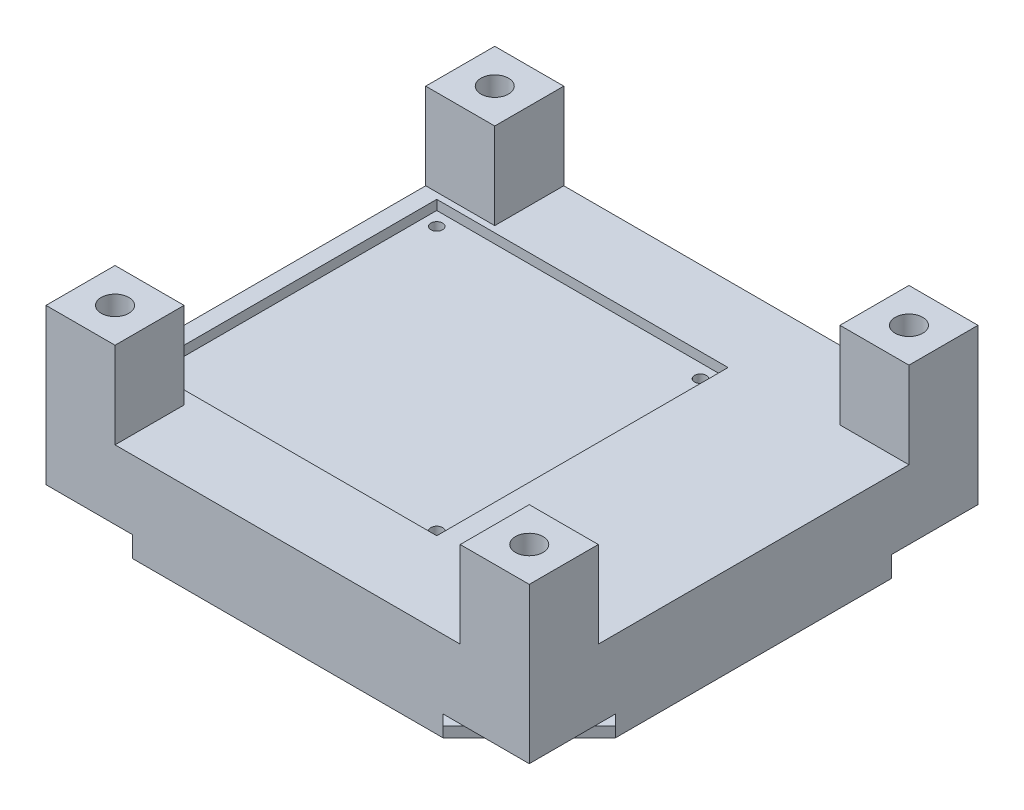
from build123d import *

# Parameters (mm, degrees)
SKETCH2_W                = 177.8
SKETCH2_H                = 165.1
BOSS_EXTRUDE1_DEPTH      = 25.4
SKETCH6_W                = 25.4
SKETCH6_H                = 25.4
BOSS_EXTRUDE2_DEPTH      = 31.75
MIRROR2_COPY_1_SKETCH_W  = 25.4
MIRROR2_COPY_1_SKETCH_H  = 25.4
MIRROR2_COPY_1_DEPTH     = 31.75
MIRROR2_COPY_2_SKETCH_W  = 25.4
MIRROR2_COPY_2_SKETCH_H  = 25.4
MIRROR2_COPY_2_DEPTH     = 31.75
SKETCH9_W                = 107.188
SKETCH9_H                = 107.188
CUT_EXTRUDE3_DEPTH       = 3.556
SKETCH10_RX              = 2.159
SKETCH10_RY              = 2.159
CUT_EXTRUDE4_DEPTH       = 20.32
MIRROR4_COPY_1_SKETCH_RX = 2.159
MIRROR4_COPY_1_SKETCH_RY = 2.159
MIRROR4_COPY_1_DEPTH     = 20.32
MIRROR4_COPY_2_SKETCH_RX = 2.159
MIRROR4_COPY_2_SKETCH_RY = 2.159
MIRROR4_COPY_2_DEPTH     = 20.32
SKETCH14_R               = 5.08
CUT_EXTRUDE5_DEPTH       = 20.32
MIRROR6_COPY_1_SKETCH_R  = 5.08
MIRROR6_COPY_1_DEPTH     = 20.32
MIRROR6_COPY_2_SKETCH_R  = 5.08
MIRROR6_COPY_2_DEPTH     = 20.32
BOSS_EXTRUDE3_DEPTH      = 7.62
SKETCH16_W               = 44.901280606
SKETCH16_H               = 3.81
CUT_EXTRUDE6_DEPTH       = 187.96
SKETCH17_W               = 44.901280606
SKETCH17_H               = 3.81
CUT_EXTRUDE7_DEPTH       = 187.96
SKETCH19_W               = 44.901280606
SKETCH19_H               = 3.81
CUT_EXTRUDE8_DEPTH       = 187.96
SKETCH20_W               = 44.901280606
SKETCH20_H               = 3.81
CUT_EXTRUDE9_DEPTH       = 187.96
SKETCH23_R               = 37.929034257
CUT_EXTRUDE10_DEPTH      = 39.37


with BuildPart() as part:
    # Sketch2 → Boss-Extrude1 (new body)
    with BuildSketch(Plane(origin=(0, 0, 0), x_dir=(1, 0, 0), z_dir=(0, 1, 0))):
        with Locations((88.9, -82.55)):
            Rectangle(SKETCH2_W, SKETCH2_H)
    extrude(amount=BOSS_EXTRUDE1_DEPTH)

    # Sketch6 → Boss-Extrude2 (add)
    with BuildSketch(Plane(origin=(0, 25.4, 0), x_dir=(1, 0, 0), z_dir=(0, 1, 0))):
        with Locations((12.7, -12.7)):
            Rectangle(SKETCH6_W, SKETCH6_H)
    boss_extrude2 = extrude(amount=BOSS_EXTRUDE2_DEPTH)

    # Mirror1: Boss-Extrude2 across plane
    add(boss_extrude2.mirror(Plane(origin=(0, 0, 82.55), x_dir=(1, 0, 0), z_dir=(0, 0, -1))))

    # Mirror2 copy 1 sketch → Mirror2 copy 1 (add)
    with BuildSketch(Plane(origin=(177.8, 25.4, 165.1), x_dir=(-1, 0, 0), z_dir=(0, 1, 0))):
        with Locations((12.7, -12.7)):
            Rectangle(MIRROR2_COPY_1_SKETCH_W, MIRROR2_COPY_1_SKETCH_H)
    extrude(amount=MIRROR2_COPY_1_DEPTH)

    # Mirror2 copy 2 sketch → Mirror2 copy 2 (add)
    with BuildSketch(Plane(origin=(177.8, 25.4, 0), x_dir=(-1, 0, 0), z_dir=(0, 1, 0))):
        with Locations((12.7, 12.7)):
            Rectangle(MIRROR2_COPY_2_SKETCH_W, MIRROR2_COPY_2_SKETCH_H)
    extrude(amount=MIRROR2_COPY_2_DEPTH)

    # Sketch9 → Cut-Extrude3 (cut)
    with BuildSketch(Plane(origin=(0, 25.4, 0), x_dir=(1, 0, 0), z_dir=(0, 1, 0))):
        with Locations((59.944, -81.276983136)):
            Rectangle(SKETCH9_W, SKETCH9_H)
    extrude(amount=-CUT_EXTRUDE3_DEPTH, mode=Mode.SUBTRACT)

    # Sketch10 → Cut-Extrude4 (cut)
    with BuildSketch(Plane(origin=(0, 21.844, 0), x_dir=(1, 0, 0), z_dir=(0, 1, 0))):
        with Locations(Location((11.43, -32.762983136), (0, 0, 56.28607255))):
            Ellipse(SKETCH10_RX, SKETCH10_RY)
    cut_extrude4 = extrude(amount=-CUT_EXTRUDE4_DEPTH, mode=Mode.SUBTRACT)

    # Mirror3: Cut-Extrude4 across plane
    add(cut_extrude4.mirror(Plane.XY.offset(81.276983136)), mode=Mode.SUBTRACT)

    # Mirror4 copy 1 sketch → Mirror4 copy 1 (cut)
    with BuildSketch(Plane(origin=(119.888, 21.844, 162.553966273), x_dir=(-1, 0, 0), z_dir=(0, 1, 0))):
        with Locations(Location((11.43, -32.762983136), (0, 0, 56.28607255))):
            Ellipse(MIRROR4_COPY_1_SKETCH_RX, MIRROR4_COPY_1_SKETCH_RY)
    extrude(amount=-MIRROR4_COPY_1_DEPTH, mode=Mode.SUBTRACT)

    # Mirror4 copy 2 sketch → Mirror4 copy 2 (cut)
    with BuildSketch(Plane(origin=(119.888, 21.844, 0), x_dir=(-1, 0, 0), z_dir=(0, 1, 0))):
        with Locations(Location((11.43, 32.762983136), (0, 0, -56.28607255))):
            Ellipse(MIRROR4_COPY_2_SKETCH_RX, MIRROR4_COPY_2_SKETCH_RY)
    extrude(amount=-MIRROR4_COPY_2_DEPTH, mode=Mode.SUBTRACT)

    # Sketch14 → Cut-Extrude5 (cut)
    with BuildSketch(Plane(origin=(0, 57.15, 0), x_dir=(1, 0, 0), z_dir=(0, 1, 0))):
        with Locations((12.7, -12.7)):
            Circle(SKETCH14_R)
    cut_extrude5 = extrude(amount=-CUT_EXTRUDE5_DEPTH, mode=Mode.SUBTRACT)

    # Mirror5: Cut-Extrude5 across plane
    add(cut_extrude5.mirror(Plane.ZY.offset(-88.9)), mode=Mode.SUBTRACT)

    # Mirror6 copy 1 sketch → Mirror6 copy 1 (cut)
    with BuildSketch(Plane(origin=(177.8, 57.15, 165.1), x_dir=(-1, 0, 0), z_dir=(0, 1, 0))):
        with Locations((12.7, -12.7)):
            Circle(MIRROR6_COPY_1_SKETCH_R)
    extrude(amount=-MIRROR6_COPY_1_DEPTH, mode=Mode.SUBTRACT)

    # Mirror6 copy 2 sketch → Mirror6 copy 2 (cut)
    with BuildSketch(Plane(origin=(0, 57.15, 165.1), x_dir=(1, 0, 0), z_dir=(0, 1, 0))):
        with Locations((12.7, 12.7)):
            Circle(MIRROR6_COPY_2_SKETCH_R)
    extrude(amount=-MIRROR6_COPY_2_DEPTH, mode=Mode.SUBTRACT)

    # Sketch15 → Boss-Extrude3 (add)
    with BuildSketch(Plane(origin=(0, 0, 0), x_dir=(-1, 0, 0), z_dir=(0, -1, 0))):
        Polygon((-146.05, 0), (-31.75, 0), (0, -31.75), (0, -133.35), (-31.75, -165.1), (-146.05, -165.1), (-177.8, -133.35), (-177.8, -31.75), align=None)
    extrude(amount=BOSS_EXTRUDE3_DEPTH)

    # Sketch16 → Cut-Extrude6 (cut)
    with BuildSketch(Plane(origin=(15.875, 0, 15.875), x_dir=(-0.7071067811865476, 0, 0.7071067811865476), z_dir=(-0.7071067811865476, 0, -0.7071067811865476))):
        with Locations((0, -1.905)):
            Rectangle(SKETCH16_W, SKETCH16_H)
    extrude(amount=-CUT_EXTRUDE6_DEPTH, mode=Mode.SUBTRACT)

    # Sketch17 → Cut-Extrude7 (cut)
    with BuildSketch(Plane(origin=(155.575, 0, 155.575), x_dir=(0.7071067811865472, 0, -0.7071067811865479), z_dir=(0.7071067811865479, 0, 0.7071067811865472))):
        with Locations((8.980256121, -1.905)):
            Rectangle(SKETCH17_W, SKETCH17_H)
    extrude(amount=-CUT_EXTRUDE7_DEPTH, mode=Mode.SUBTRACT)

    # Sketch19 → Cut-Extrude8 (cut)
    with BuildSketch(Plane(origin=(-66.675, 0, 66.675), x_dir=(0.7071067811865472, 0, 0.7071067811865479), z_dir=(-0.7071067811865479, 0, 0.7071067811865472))):
        with Locations((116.743329574, -1.905)):
            Rectangle(SKETCH19_W, SKETCH19_H)
    extrude(amount=-CUT_EXTRUDE8_DEPTH, mode=Mode.SUBTRACT)

    # Sketch20 → Cut-Extrude9 (cut)
    with BuildSketch(Plane(origin=(73.025, 0, -73.025), x_dir=(-0.7071067811865475, 0, -0.7071067811865476), z_dir=(0.7071067811865476, 0, -0.7071067811865475))):
        with Locations((-125.723585695, -1.905)):
            Rectangle(SKETCH20_W, SKETCH20_H)
    extrude(amount=-CUT_EXTRUDE9_DEPTH, mode=Mode.SUBTRACT)

    # Sketch23 → Cut-Extrude10 (cut)
    with BuildSketch(Plane.XZ):
        with Locations((88.9, 82.55)):
            Circle(SKETCH23_R)
    extrude(amount=CUT_EXTRUDE10_DEPTH, mode=Mode.SUBTRACT)


solid = part.part
